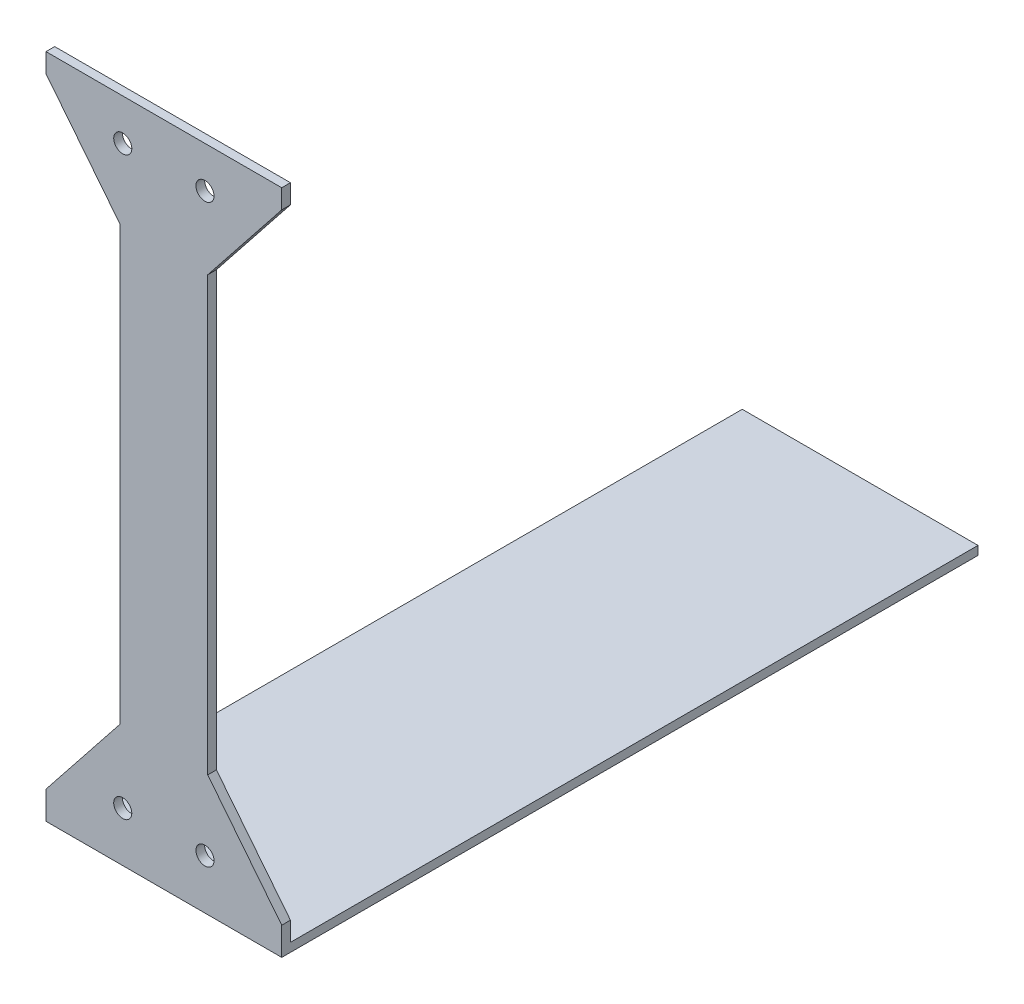
from build123d import *

# Parameters (mm, degrees)
BOSS_EXTRUDE1_DEPTH = 1.5875
SKETCH2_W           = 43
SKETCH2_H           = 127
BOSS_EXTRUDE2_DEPTH = 1.5875


with BuildPart() as part:
    # Sketch1 → Boss-Extrude1 (new body)
    with BuildSketch(Plane.XY):
        Polygon((-117, 99.5), (-103.5, 116.5), (-103.5, 120), (-146.5, 120), (-146.5, 116.5), (-133, 99.5), (-133, 20.5), (-146.5, 3.5), (-146.5, 0), (-103.5, 0), (-103.5, 3.5), (-117, 20.5), align=None)
        with BuildLine():
            ThreePointArc((-134.15, 112.5), (-132.5, 110.85), (-130.85, 112.5))
            ThreePointArc((-130.85, 112.5), (-132.5, 114.15), (-134.15, 112.5))
        make_face(mode=Mode.SUBTRACT)
        with BuildLine():
            ThreePointArc((-119.15, 112.5), (-117.5, 110.85), (-115.85, 112.5))
            ThreePointArc((-115.85, 112.5), (-117.5, 114.15), (-119.15, 112.5))
        make_face(mode=Mode.SUBTRACT)
        with BuildLine():
            ThreePointArc((-115.85, 7.5), (-117.5, 9.15), (-119.15, 7.5))
            ThreePointArc((-119.15, 7.5), (-117.5, 5.85), (-115.85, 7.5))
        make_face(mode=Mode.SUBTRACT)
        with BuildLine():
            ThreePointArc((-134.15, 7.5), (-132.5, 5.85), (-130.85, 7.5))
            ThreePointArc((-130.85, 7.5), (-132.5, 9.15), (-134.15, 7.5))
        make_face(mode=Mode.SUBTRACT)
    extrude(amount=BOSS_EXTRUDE1_DEPTH)

    # Sketch2 → Boss-Extrude2 (add)
    with BuildSketch(Plane(origin=(0, 0, 0), x_dir=(1, 0, 0), z_dir=(0, 1, 0))):
        with Locations((-125, 61.9125)):
            Rectangle(SKETCH2_W, SKETCH2_H)
    extrude(amount=-BOSS_EXTRUDE2_DEPTH)


solid = part.part
